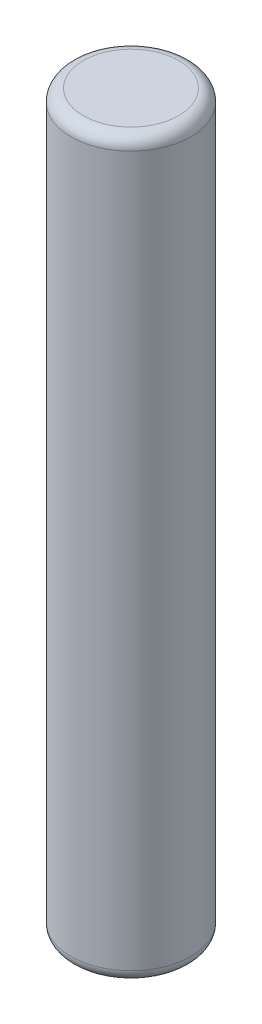
from build123d import *

# Parameters (mm, degrees)
SKETCH1_R           = 2.45
BOSS_EXTRUDE1_DEPTH = 30
FILLET1_R           = 0.5


with BuildPart() as part:
    # Sketch1 → Boss-Extrude1 (new body)
    with BuildSketch(Plane(origin=(0, 0, 0), x_dir=(1, 0, 0), z_dir=(0, 1, 0))):
        Circle(SKETCH1_R)
    extrude(amount=BOSS_EXTRUDE1_DEPTH)

    # Fillet1
    fillet1_edges = [part.edges().sort_by_distance(p)[0] for p in [
        (-2.45, 0, 0),
        (-2.45, 30, 0),
    ]]
    fillet(fillet1_edges, radius=FILLET1_R)


solid = part.part
